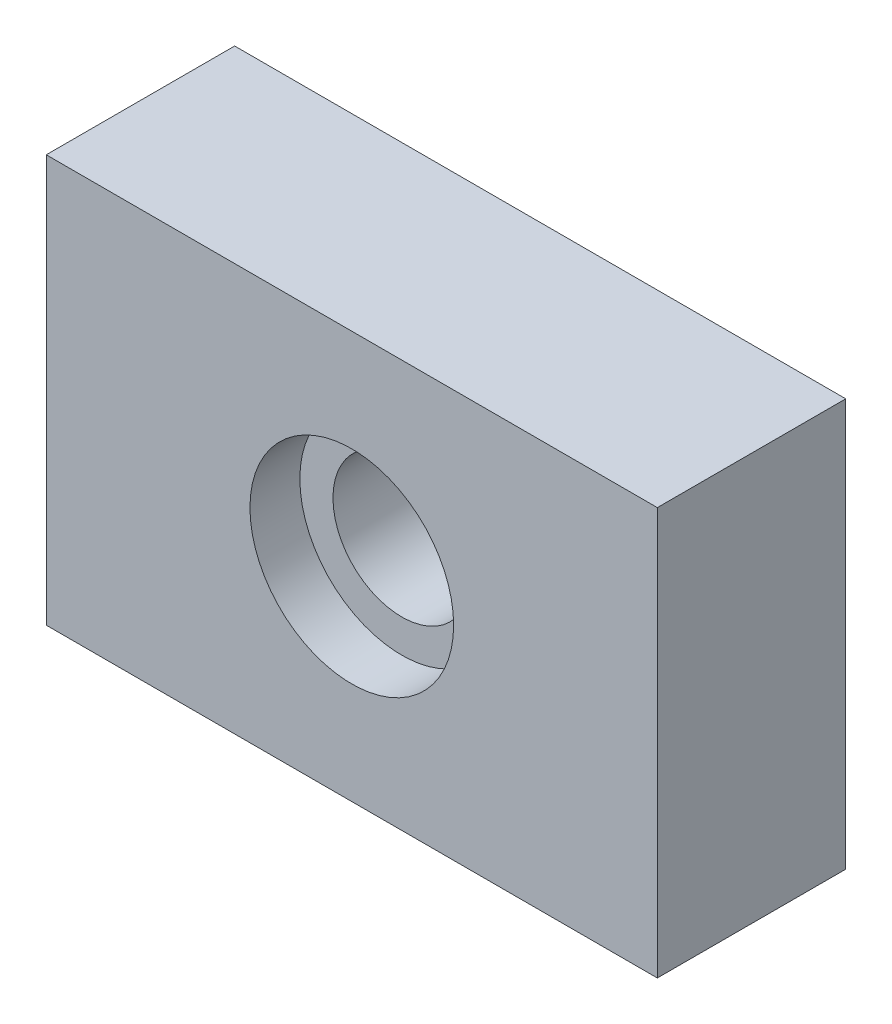
from build123d import *

# Parameters (mm, degrees)
SKETCH1_W                       = 152.4
SKETCH1_H                       = 101.6
BOSS_EXTRUDE1_DEPTH             = 46.99
SKETCH2_R                       = 17.145
CUT_EXTRUDE1_DEPTH              = 190.093574983
SKETCH2_2_R                     = 25.4
SKETCH2_2_R_2                   = 17.145
CUT_EXTRUDE3_DEPTH              = 12.446
TAP_DRILL_FOR_1_2_13_TAP1_D     = 10.71626
TAP_DRILL_FOR_1_2_13_TAP1_DEPTH = 19.05
TAP_DRILL_FOR_1_2_13_TAP1_TIP   = 3.219489309


with BuildPart() as part:
    # Sketch1 → Boss-Extrude1 (new body)
    with BuildSketch(Plane.XY):
        with Locations((76.2, 50.8)):
            Rectangle(SKETCH1_W, SKETCH1_H)
    extrude(amount=BOSS_EXTRUDE1_DEPTH)

    # Sketch2 → Cut-Extrude1 (cut, through all)
    with BuildSketch(Plane(origin=(0, 0, 0), x_dir=(-1, 0, 0), z_dir=(0, 0, -1))):
        with Locations((-76.2, 50.8)):
            Circle(SKETCH2_R)
    extrude(amount=-CUT_EXTRUDE1_DEPTH, mode=Mode.SUBTRACT)

    # Sketch2<2> → Cut-Extrude3 (cut)
    with BuildSketch(Plane(origin=(0, 0, 0), x_dir=(-1, 0, 0), z_dir=(0, 0, -1))):
        with Locations((-76.2, 50.8)):
            Circle(SKETCH2_2_R)
        with Locations((-76.2, 50.8)):
            Circle(SKETCH2_2_R_2, mode=Mode.SUBTRACT)
    cut_extrude3 = extrude(amount=-CUT_EXTRUDE3_DEPTH, mode=Mode.SUBTRACT)

    # Mirror2: Cut-Extrude3 across plane
    add(cut_extrude3.mirror(Plane(origin=(0, 0, 23.495), x_dir=(1, 0, 0), z_dir=(0, 0, -1))), mode=Mode.SUBTRACT)

    # Tap Drill for 1/2-13 Tap1
    with Locations(Plane(origin=(0, 0, 0), x_dir=(-1, 0, 0), z_dir=(0, -1, 0))):
        with Locations((-68.051669078, -23.495), (-29.951669078, -23.495)):
            Hole(TAP_DRILL_FOR_1_2_13_TAP1_D / 2, depth=TAP_DRILL_FOR_1_2_13_TAP1_DEPTH)
            with Locations((0, 0, -(TAP_DRILL_FOR_1_2_13_TAP1_DEPTH + TAP_DRILL_FOR_1_2_13_TAP1_TIP / 2))):  # 118° drill point
                Cone(0, TAP_DRILL_FOR_1_2_13_TAP1_D / 2, TAP_DRILL_FOR_1_2_13_TAP1_TIP, mode=Mode.SUBTRACT)


solid = part.part
